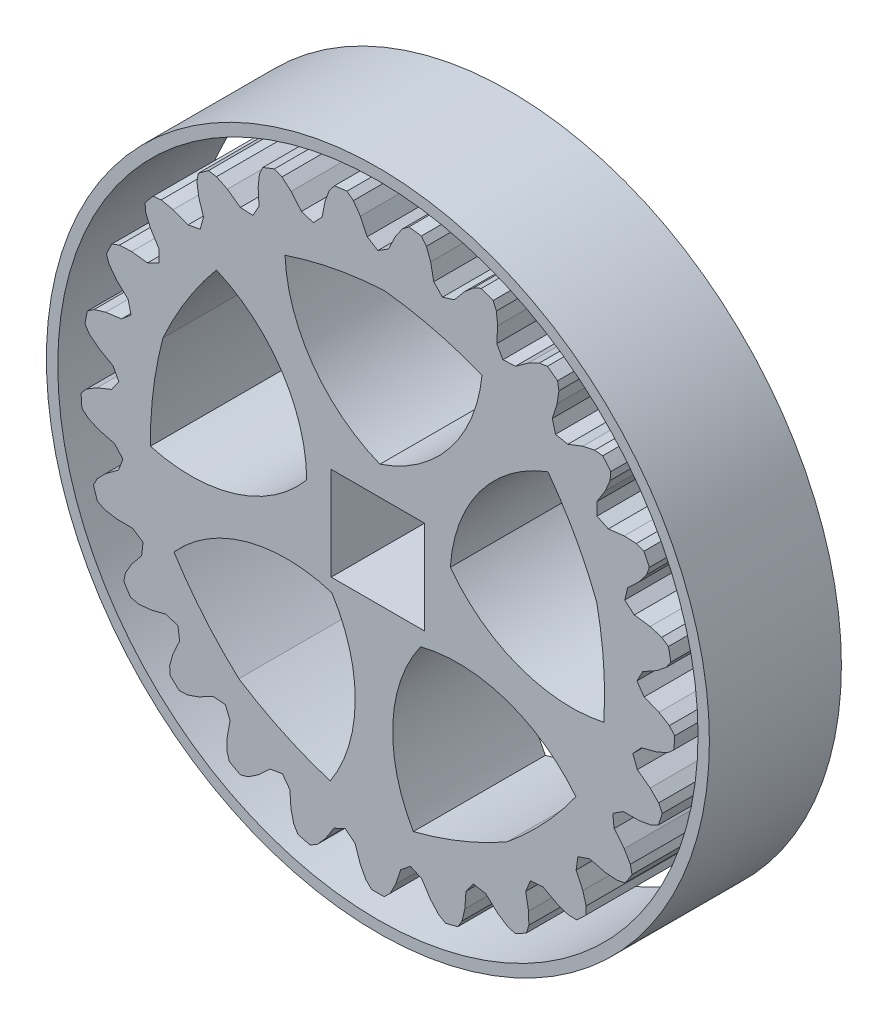
from build123d import *

# Parameters (mm, degrees)
SKETCH1_R           = 22.5
SKETCH1_W           = 7.071067812
SKETCH1_H           = 7.071067812
BOSS_EXTRUDE1_DEPTH = 10
CUT_EXTRUDE1_DEPTH  = 34.35416016
CIRPATTERN1_COUNT   = 25
CUT_EXTRUDE2_DEPTH  = 34.341036646
SKETCH5_R           = 25.109802293
SKETCH5_R_2         = 24.249619568
BOSS_EXTRUDE2_DEPTH = 10
CIRPATTERN2_COUNT   = 5


with BuildPart() as part:
    # Sketch1 → Boss-Extrude1 (new body)
    with BuildSketch(Plane.XY):
        Circle(SKETCH1_R)
        Rectangle(SKETCH1_W, SKETCH1_H, mode=Mode.SUBTRACT)
    extrude(amount=BOSS_EXTRUDE1_DEPTH)

    # Sketch2 → Cut-Extrude1 (cut, through all)
    with BuildSketch(Plane.XY):
        Polygon((0, 19.65893996), (-0.806852748, 20.157299569), (-1.329964738, 21.247116215), (-1.855743872, 22.002722423), (-2.345280266, 22.377436414), (-1.855743872, 23.661103901), (0, 24.25702385), (1.855743872, 23.661103901), (2.345280266, 22.377436414), (1.855743872, 22.002722423), (1.329964738, 21.247116215), (0.806852748, 20.157299569), align=None)
    cut_extrude1 = extrude(amount=CUT_EXTRUDE1_DEPTH, mode=Mode.SUBTRACT)

    # CirPattern1: Cut-Extrude1 ×25 about axis
    cirpattern1_axis = Axis((0, 0, 10), (0, 0, -1))
    for i in range(1, CIRPATTERN1_COUNT):
        add(cut_extrude1.rotate(cirpattern1_axis, i * 360 / CIRPATTERN1_COUNT), mode=Mode.SUBTRACT)

    # Sketch4 → Cut-Extrude2 (cut, symmetric)
    with BuildSketch(Plane.XY):
        with BuildLine():
            ThreePointArc((0.155864103, 5.718264267), (-4.934093797, 9.712812955), (-7.035050951, 15.832459159))
            ThreePointArc((-7.035050951, 15.832459159), (-3.330547859, 16.80467188), (0.470787006, 17.271998294))
            ThreePointArc((0.470787006, 17.271998294), (4.241020464, 16.598291823), (7.887062745, 15.425723522))
            ThreePointArc((7.887062745, 15.425723522), (5.455863455, 9.429611394), (0.155864103, 5.718264267))
        make_face()
    cut_extrude2 = extrude(amount=CUT_EXTRUDE2_DEPTH, both=True, mode=Mode.SUBTRACT)

    # CirPattern2: Cut-Extrude2 ×5 about axis
    cirpattern2_axis = Axis((0, 0, 10), (0, 0, -1))
    for i in range(1, CIRPATTERN2_COUNT):
        add(cut_extrude2.rotate(cirpattern2_axis, i * 360 / CIRPATTERN2_COUNT), mode=Mode.SUBTRACT)


with BuildPart() as body_2:
    # Sketch5 → Boss-Extrude2 (new body)
    with BuildSketch(Plane.XY):
        Circle(SKETCH5_R)
        Circle(SKETCH5_R_2, mode=Mode.SUBTRACT)
    extrude(amount=BOSS_EXTRUDE2_DEPTH)


solid = Compound([part.part, body_2.part])
